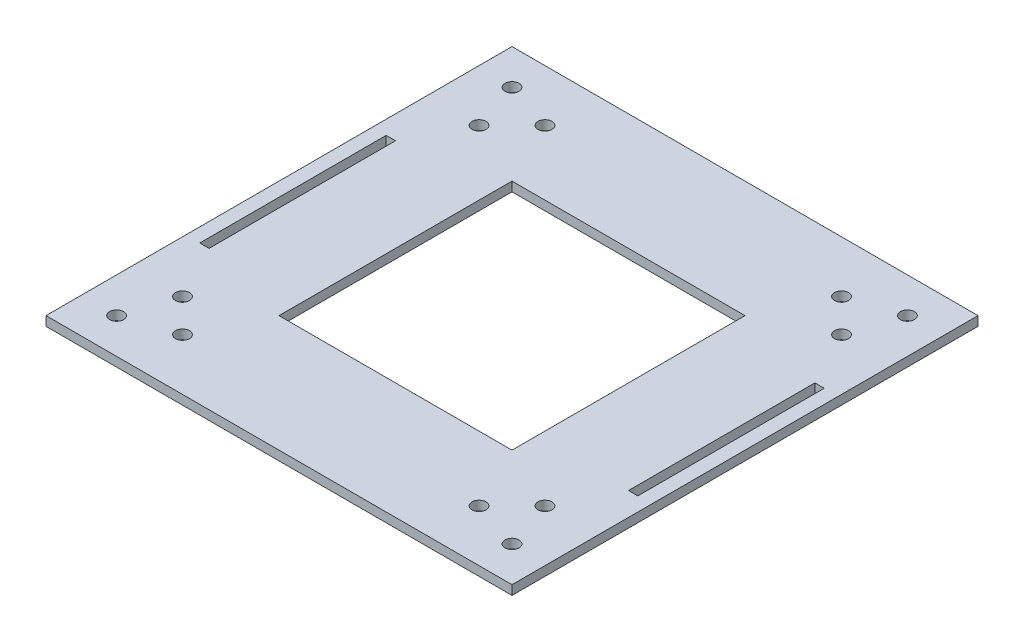
from build123d import *

# Parameters (mm, degrees)
SKETCH_1_W          = 100
SKETCH_1_H          = 100
EXTRUDE_1_DEPTH     = 2
SKETCH_3_R          = 1.5
CUT_EXTRUDE_2_DEPTH = 71.738956735
SKETCH_4_W          = 50
SKETCH_4_H          = 50
CUT_EXTRUDE_3_DEPTH = 71.738956735
SKETCH_5_W          = 2
SKETCH_5_H          = 40
CUT_EXTRUDE_4_DEPTH = 71.738956735


with BuildPart() as part:
    # 草图1 → 凸台-拉伸1 (new body)
    with BuildSketch(Plane(origin=(0, 0, 0), x_dir=(1, 0, 0), z_dir=(0, 1, 0))):
        Rectangle(SKETCH_1_W, SKETCH_1_H)
    extrude(amount=EXTRUDE_1_DEPTH)

    # 草图3 → 切除-拉伸2 (cut, through all)
    with BuildSketch(Plane(origin=(0, 2, 0), x_dir=(1, 0, 0), z_dir=(0, 1, 0))):
        with Locations((-42.426406871, 42.426406871)):
            Circle(SKETCH_3_R)
        with Locations((-31.819805153, 38.890872965)):
            Circle(SKETCH_3_R)
        with Locations((-38.890872965, 31.819805153)):
            Circle(SKETCH_3_R)
        with Locations((-31.819805153, -38.890872965)):
            Circle(SKETCH_3_R)
        with Locations((-38.890872965, -31.819805153)):
            Circle(SKETCH_3_R)
        with Locations((-42.426406871, -42.426406871)):
            Circle(SKETCH_3_R)
        with Locations((31.819805153, 38.890872965)):
            Circle(SKETCH_3_R)
        with Locations((38.890872965, 31.819805153)):
            Circle(SKETCH_3_R)
        with Locations((42.426406871, 42.426406871)):
            Circle(SKETCH_3_R)
        with Locations((31.819805153, -38.890872965)):
            Circle(SKETCH_3_R)
        with Locations((42.426406871, -42.426406871)):
            Circle(SKETCH_3_R)
        with Locations((38.890872965, -31.819805153)):
            Circle(SKETCH_3_R)
    extrude(amount=-CUT_EXTRUDE_2_DEPTH, mode=Mode.SUBTRACT)

    # 草图4 → 切除-拉伸3 (cut, through all)
    with BuildSketch(Plane(origin=(0, 2, 0), x_dir=(1, 0, 0), z_dir=(0, 1, 0))):
        Rectangle(SKETCH_4_W, SKETCH_4_H)
    extrude(amount=-CUT_EXTRUDE_3_DEPTH, mode=Mode.SUBTRACT)

    # 草图5 → 切除-拉伸4 (cut, through all)
    with BuildSketch(Plane(origin=(0, 2, 0), x_dir=(1, 0, 0), z_dir=(0, 1, 0))):
        with Locations((-46, 0)):
            Rectangle(SKETCH_5_W, SKETCH_5_H)
        with Locations((46, 0)):
            Rectangle(SKETCH_5_W, SKETCH_5_H)
    extrude(amount=-CUT_EXTRUDE_4_DEPTH, mode=Mode.SUBTRACT)


solid = part.part
